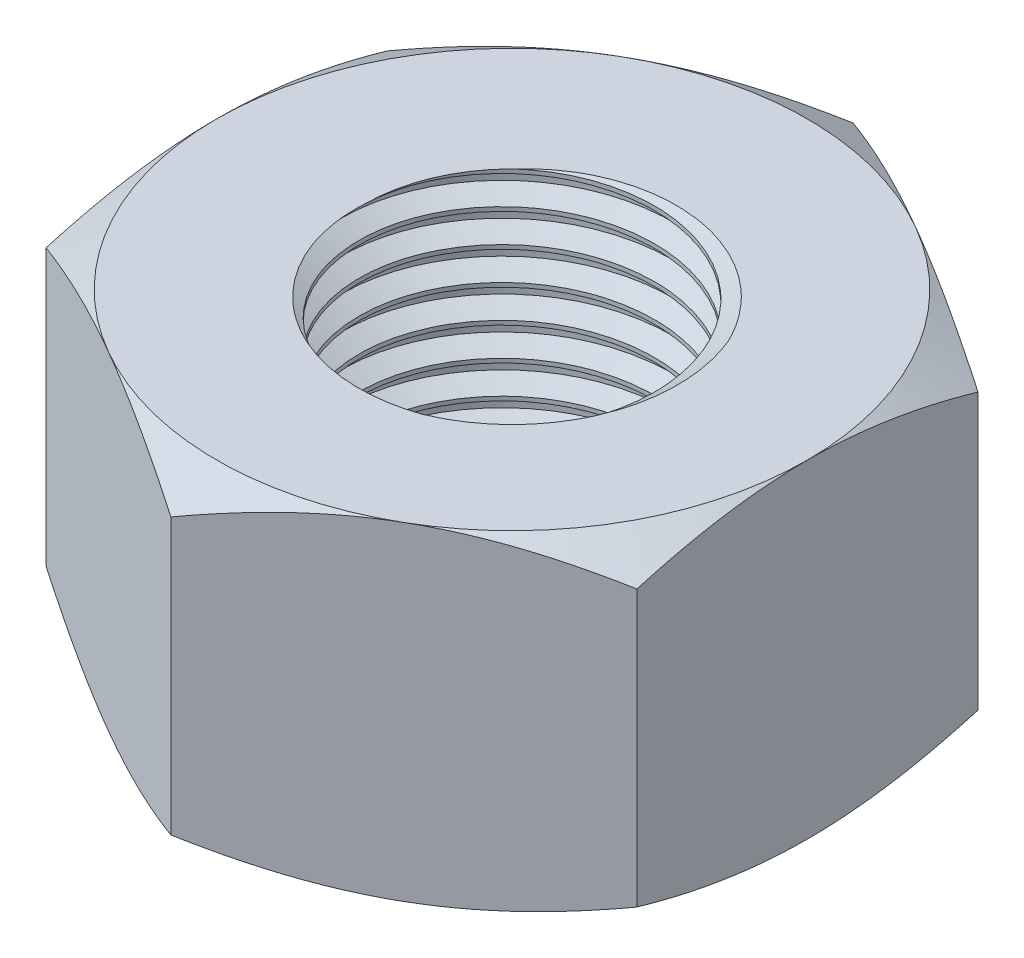
from build123d import *

# Parameters (mm, degrees)
SKETCH1_R           = 4.5
BOSS_EXTRUDE1_DEPTH = 5
THREAD1_PITCH       = 1


with BuildPart() as part:
    # Sketch1 → Boss-Extrude1 (new, symmetric)
    with BuildSketch(Plane(origin=(0, 0, 0), x_dir=(1, 0, 0), z_dir=(0, 1, 0))):
        Polygon((9, -5.196152423), (9, 5.196152423), (0, 10.392304845), (-9, 5.196152423), (-9, -5.196152423), (0, -10.392304845), align=None)
        with Locations(Location((0, 0, 0), (0, 0, 270))):
            Circle(SKETCH1_R, mode=Mode.SUBTRACT)
    extrude(amount=BOSS_EXTRUDE1_DEPTH, both=True)

    # Sketch3 → Cut-Revolve1 (revolve, cut)
    with BuildSketch(Plane.XY):
        Polygon((9, -5), (10.705590756, -5), (10.705590756, -4.015276718), align=None)
        Polygon((10.705590756, 4.015276718), (9, 5), (10.705590756, 5), align=None)
    revolve(axis=Axis((0, 0, 0), (0, -1, 0)), mode=Mode.SUBTRACT)

    # Thread1: the profile of Thread Profile1 profile screwed along a right-hand helix of 14 turns, 8 arcs to a turn; built about Z, then put on its axis
    thread1_z = Axis((0, 0, 0), (0, 0, 1))
    thread1_corners = [(4.4997, 0, -0.000173205), (4.4997, 0, 0.875173202), (5.041265875, 0, 0.562499999), (5.041265875, 0, 0.312499999)]
    with BuildLine(mode=Mode.PRIVATE) as thread1_profile:
        Line(thread1_corners[0], thread1_corners[1])
        Line(thread1_corners[1], thread1_corners[2])
        Line(thread1_corners[2], thread1_corners[3])
        Line(thread1_corners[3], thread1_corners[0])
    thread1_cap = Face(thread1_profile.wire())
    thread1_turn_angles = [0, 22.5, 45, 67.5, 90, 112.5, 135, 157.5, 180, 202.5, 225, 247.5, 270, 292.5, 315, 337.5, 360]
    thread1_turn_weights = [1, 0.9238795325112867, 1, 0.9238795325112867, 1, 0.9238795325112867, 1, 0.9238795325112867, 1, 0.9238795325112867, 1, 0.9238795325112867, 1, 0.9238795325112867, 1, 0.9238795325112867, 1]
    thread1_turn_rails = [Edge.make_bspline([Vector(p[0], p[1], 0).rotate(thread1_z, thread1_turn_angles[k]) / thread1_turn_weights[k] + Vector(0, 0, p[2] + THREAD1_PITCH * thread1_turn_angles[k] / 360) for k in range(17)], [0, 0, 0, 1, 1, 2, 2, 3, 3, 4, 4, 5, 5, 6, 6, 7, 7, 8, 8, 8], 2, thread1_turn_weights) for p in thread1_corners]
    thread1_turn_sides = [Face.make_surface_from_curves(thread1_turn_rails[p[0]], thread1_turn_rails[p[1]]) for p in [(0, 1), (1, 2), (2, 3), (3, 0)]]
    thread1 = Plane(origin=(0, 7, 0), x_dir=(-1, 0, 0), z_dir=(0, -1, 0)) * Solid(Shell([*[p.moved(Location((0, 0, THREAD1_PITCH * i))) for i in range(14) for p in thread1_turn_sides], thread1_cap, thread1_cap.rotate(thread1_z, 5040).moved(Location((0, 0, THREAD1_PITCH * 5040 / 360)))]))
    add(thread1, mode=Mode.SUBTRACT)


solid = part.part
